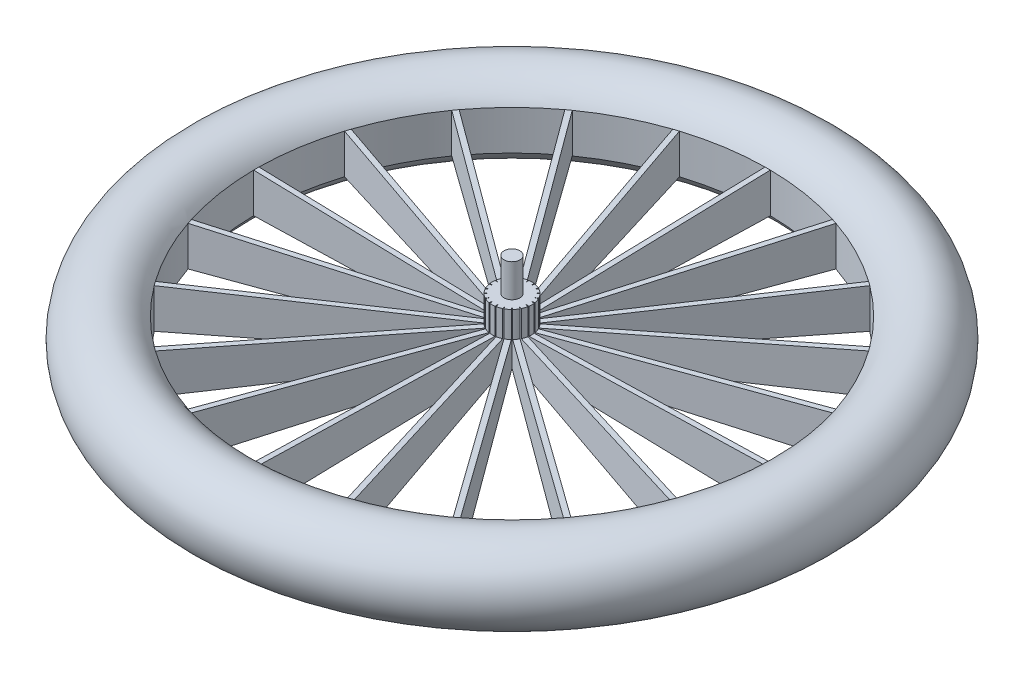
from build123d import *

# Parameters (mm, degrees)
ENL_V_MAT_EXTRU_2_DEPTH      = 358.805813396
ENL_V_MAT_EXTRU_2_DEPTH_BACK = 358.805813396


with BuildPart() as part:
    # Esquisse1 → Révolution1 (revolve)
    with BuildSketch(Plane.XY):
        with BuildLine():
            Line((-6, -10), (-6, 10))
            Line((-6, 10), (0, 10))
            Line((0, 10), (0, 55))
            Line((0, 55), (-6, 55))
            Line((-6, 55), (-6, 30))
            Line((-6, 30), (-15, 30))
            Line((-15, 30), (-15, 10.239337211))
            Line((-15, 10.239337211), (-194.019237886, 15))
            ThreePointArc((-194.019237886, 15), (-250, 0), (-194.019237886, -15))
            Line((-194.019237886, -15), (-6, -10))
        make_face()
    revolve(axis=Axis((0, 30, 0), (0, -1, 0)))

    # Esquisse4 → Enlèv. mat.-Extru.2 (cut, two sides: drawn at the far end of the back side and taken through both)
    with BuildSketch(Plane(origin=(0, 0, 0), x_dir=(1, 0, 0), z_dir=(0, 1, 0)).offset(-ENL_V_MAT_EXTRU_2_DEPTH_BACK)):
        with BuildLine():
            ThreePointArc((58.049943199, 185.131490473), (30.351295686, 191.630539112), (2, 194.008929356))
            Line((2, 194.008929356), (2, 12.627503029))
            Line((2, 12.627503029), (58.049943199, 185.131490473))
        make_face()
        with BuildLine():
            Line((-2, 12.627503029), (-2, 194.008929356))
            ThreePointArc((-2, 194.008929356), (-30.351295686, 191.630539112), (-58.049943199, 185.131490473))
            Line((-58.049943199, 185.131490473), (-2, 12.627503029))
        make_face()
        with BuildLine():
            ThreePointArc((112.4175535, 158.132091414), (88.082890767, 172.872406775), (61.854169264, 183.895422495))
            Line((61.854169264, 183.895422495), (5.804226065, 11.391435052))
            Line((5.804226065, 11.391435052), (112.4175535, 158.132091414))
        make_face()
        with BuildLine():
            Line((-5.804226065, 11.391435052), (-61.854169264, 183.895422495))
            ThreePointArc((-61.854169264, 183.895422495), (-88.082890767, 172.872406775), (-112.4175535, 158.132091414))
            Line((-112.4175535, 158.132091414), (-5.804226065, 11.391435052))
        make_face()
        with BuildLine():
            ThreePointArc((155.780950405, 115.653621478), (137.19231879, 137.19231879), (115.653621478, 155.780950405))
            Line((115.653621478, 155.780950405), (9.040294043, 9.040294043))
            Line((9.040294043, 9.040294043), (155.780950405, 115.653621478))
        make_face()
        with BuildLine():
            Line((-9.040294043, 9.040294043), (-115.653621478, 155.780950405))
            ThreePointArc((-115.653621478, 155.780950405), (-137.19231879, 137.19231879), (-155.780950405, 115.653621478))
            Line((-155.780950405, 115.653621478), (-9.040294043, 9.040294043))
        make_face()
        with BuildLine():
            ThreePointArc((183.895422495, 61.854169264), (172.872406775, 88.082890767), (158.132091414, 112.4175535))
            Line((158.132091414, 112.4175535), (11.391435052, 5.804226065))
            Line((11.391435052, 5.804226065), (183.895422495, 61.854169264))
        make_face()
        with BuildLine():
            Line((-11.391435052, 5.804226065), (-158.132091414, 112.4175535))
            ThreePointArc((-158.132091414, 112.4175535), (-172.872406775, 88.082890767), (-183.895422495, 61.854169264))
            Line((-183.895422495, 61.854169264), (-11.391435052, 5.804226065))
        make_face()
        with BuildLine():
            ThreePointArc((194.008929356, 2), (191.630539112, 30.351295686), (185.131490473, 58.049943199))
            Line((185.131490473, 58.049943199), (12.627503029, 2))
            Line((12.627503029, 2), (194.008929356, 2))
        make_face()
        with BuildLine():
            Line((-12.627503029, 2), (-185.131490473, 58.049943199))
            ThreePointArc((-185.131490473, 58.049943199), (-191.630539112, 30.351295686), (-194.008929356, 2))
            Line((-194.008929356, 2), (-12.627503029, 2))
        make_face()
        with BuildLine():
            Line((-12.627503029, -2), (-194.008929356, -2))
            ThreePointArc((-194.008929356, -2), (-191.630539112, -30.351295686), (-185.131490473, -58.049943199))
            Line((-185.131490473, -58.049943199), (-12.627503029, -2))
        make_face()
        with BuildLine():
            ThreePointArc((185.131490473, -58.049943199), (191.630539112, -30.351295686), (194.008929356, -2))
            Line((194.008929356, -2), (12.627503029, -2))
            Line((12.627503029, -2), (185.131490473, -58.049943199))
        make_face()
        with BuildLine():
            Line((-11.391435052, -5.804226065), (-183.895422495, -61.854169264))
            ThreePointArc((-183.895422495, -61.854169264), (-172.872406775, -88.082890767), (-158.132091414, -112.4175535))
            Line((-158.132091414, -112.4175535), (-11.391435052, -5.804226065))
        make_face()
        with BuildLine():
            ThreePointArc((158.132091414, -112.4175535), (172.872406775, -88.082890767), (183.895422495, -61.854169264))
            Line((183.895422495, -61.854169264), (11.391435052, -5.804226065))
            Line((11.391435052, -5.804226065), (158.132091414, -112.4175535))
        make_face()
        with BuildLine():
            Line((-9.040294043, -9.040294043), (-155.780950405, -115.653621478))
            ThreePointArc((-155.780950405, -115.653621478), (-137.19231879, -137.19231879), (-115.653621478, -155.780950405))
            Line((-115.653621478, -155.780950405), (-9.040294043, -9.040294043))
        make_face()
        with BuildLine():
            ThreePointArc((115.653621478, -155.780950405), (137.19231879, -137.19231879), (155.780950405, -115.653621478))
            Line((155.780950405, -115.653621478), (9.040294043, -9.040294043))
            Line((9.040294043, -9.040294043), (115.653621478, -155.780950405))
        make_face()
        with BuildLine():
            Line((-5.804226065, -11.391435052), (-112.4175535, -158.132091414))
            ThreePointArc((-112.4175535, -158.132091414), (-88.082890767, -172.872406775), (-61.854169264, -183.895422495))
            Line((-61.854169264, -183.895422495), (-5.804226065, -11.391435052))
        make_face()
        with BuildLine():
            ThreePointArc((61.854169264, -183.895422495), (88.082890767, -172.872406775), (112.4175535, -158.132091414))
            Line((112.4175535, -158.132091414), (5.804226065, -11.391435052))
            Line((5.804226065, -11.391435052), (61.854169264, -183.895422495))
        make_face()
        with BuildLine():
            Line((-2, -12.627503029), (-58.049943199, -185.131490473))
            ThreePointArc((-58.049943199, -185.131490473), (-30.351295686, -191.630539112), (-2, -194.008929356))
            Line((-2, -194.008929356), (-2, -12.627503029))
        make_face()
        with BuildLine():
            ThreePointArc((2, -194.008929356), (30.351295686, -191.630539112), (58.049943199, -185.131490473))
            Line((58.049943199, -185.131490473), (2, -12.627503029))
            Line((2, -12.627503029), (2, -194.008929356))
        make_face()
    extrude(amount=ENL_V_MAT_EXTRU_2_DEPTH + ENL_V_MAT_EXTRU_2_DEPTH_BACK, mode=Mode.SUBTRACT)


solid = part.part
